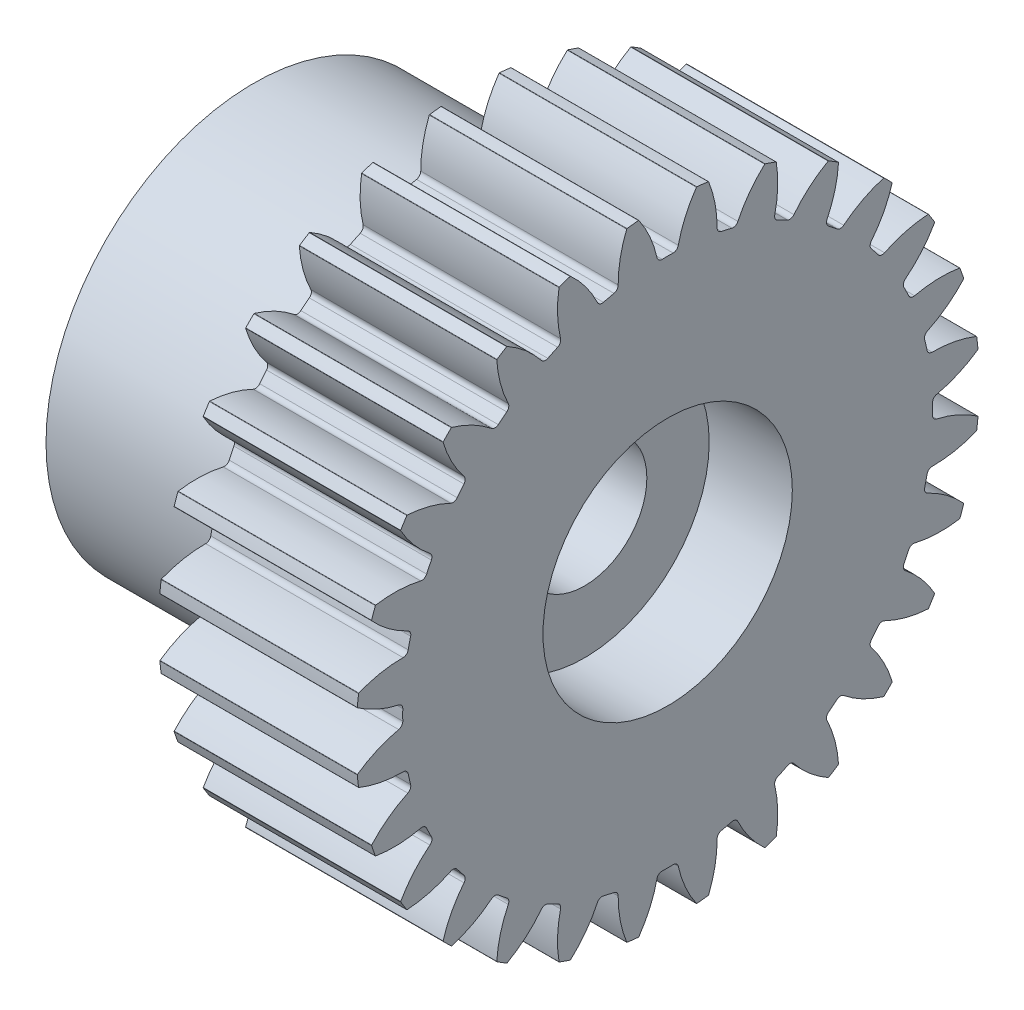
from build123d import *
from build123d.topology import SkipClean

# Parameters (mm, degrees)
BASPROSKE_W                = 5
BASPROSKE_H                = 7.5
TOOTHCUT_DEPTH             = 12.7260394
BREAKS_R                   = 0.01
ROOTFILLETS_R              = 0.126
TEETHCUTS_COUNT            = 28
TEETHCUTS_ANGLE            = 347.142857143
BREAKS_OF_TEETHCUTS_R      = 0.01
ROOTFILLETS_OF_TEETHCUTS_R = 0.126
HUBNEARONE_START           = 5.20666667
HUBNEAONESKE_R             = 6.374
HUBNEARONE_DEPTH           = 5.20666667
BORSKE_R                   = 1.5
BORE_DEPTH                 = 50.0000508
SKETCH1_R                  = 6.374
SKETCH1_R_2                = 5
CUT_EXTRUDE1_DEPTH         = 5.20666667
SKETCH2_R                  = 3
CUT_EXTRUDE2_DEPTH         = 2.25
CUT_EXTRUDE5_DEPTH         = 3.8
SKETCH7_R                  = 8.783824002
CUT_EXTRUDE6_DEPTH         = 0.25


with BuildPart() as part:
    # BasProSke → Base-Revolve (revolve)
    with BuildSketch(Plane(origin=(0, 0, 0), x_dir=(1, 0, 0), z_dir=(0, 1, 0)), mode=Mode.PRIVATE) as base_revolve_sk:
        with Locations((2.5, 3.75)):
            Rectangle(BASPROSKE_W, BASPROSKE_H)
    revolve(base_revolve_sk.sketch.rotate(Axis((-10, 0, 0), (1, 0, 0)), 180), axis=Axis((-10, 0, 0), (1, 0, 0)))

    # TooCutSke → ToothCut (cut, through all)
    with BuildSketch(Plane(origin=(0, 0, 0), x_dir=(0, 0, -1), z_dir=(1, 0, 0))):
        with BuildLine():
            ThreePointArc((0.235575921, 6.369645201), (0, 6.374), (-0.235575921, 6.369645201))
            ThreePointArc((-0.235575921, 6.369645201), (-0.412688204, 6.956904444), (-0.713425358, 7.491506485))
            ThreePointArc((-0.713425358, 7.491506485), (0, 7.5254), (0.713425358, 7.491506485))
            ThreePointArc((0.713425358, 7.491506485), (0.412688204, 6.956904444), (0.235575921, 6.369645201))
        make_face()
    toothcut = extrude(amount=TOOTHCUT_DEPTH, mode=Mode.SUBTRACT)

    # Breaks
    breaks_edges = [part.edges().sort_by_distance(p)[0] for p in [
        (2.5, 7.467592583, -0.696463213),
        (2.5, 7.467592583, 0.696463213),
    ]]
    fillet(breaks_edges, radius=BREAKS_R)

    # RootFillets
    rootfillets_edges = [part.edges().sort_by_distance(p)[0] for p in [
        (2.5, 6.369645201, -0.235575921),
        (2.5, 6.369645201, 0.235575921),
    ]]
    fillet(rootfillets_edges, radius=ROOTFILLETS_R)

    # TeethCuts: ToothCut ×28 about axis
    teethcuts_axis = Axis((-10, 0, 0), (1, 0, 0))
    for i in range(1, TEETHCUTS_COUNT):
        add(toothcut.rotate(teethcuts_axis, i * TEETHCUTS_ANGLE / (TEETHCUTS_COUNT - 1)), mode=Mode.SUBTRACT)

    # Breaks of TeethCuts
    breaks_of_teethcuts_edges = [part.edges().sort_by_distance(p)[0] for p in [
        (2.5, 7.435342091, 0.982694249),
        (2.5, 7.125386802, 2.340697103),
        (2.5, 7.030252499, 2.612575319),
        (2.5, 6.425884373, 3.867558665),
        (2.5, 6.272636691, 4.111450954),
        (2.5, 5.404161269, 5.200484687),
        (2.5, 5.200484687, 5.404161269),
        (2.5, 4.111450954, 6.272636691),
        (2.5, 3.867558665, 6.425884373),
        (2.5, 2.612575319, 7.030252499),
        (2.5, 2.340697103, 7.125386802),
        (2.5, 0.982694249, 7.435342091),
        (2.5, 0.696463213, 7.467592583),
        (2.5, -0.696463213, 7.467592583),
        (2.5, -0.982694249, 7.435342091),
        (2.5, -2.340697103, 7.125386802),
        (2.5, -2.612575319, 7.030252499),
        (2.5, -3.867558665, 6.425884373),
        (2.5, -4.111450954, 6.272636691),
        (2.5, -5.200484687, 5.404161269),
        (2.5, -5.404161269, 5.200484687),
        (2.5, -6.272636691, 4.111450954),
        (2.5, -6.425884373, 3.867558665),
        (2.5, -7.030252499, 2.612575319),
        (2.5, -7.125386802, 2.340697103),
        (2.5, -7.435342091, 0.982694249),
        (2.5, -7.467592583, 0.696463213),
        (2.5, -7.467592583, -0.696463213),
        (2.5, -7.435342091, -0.982694249),
        (2.5, -7.125386802, -2.340697103),
        (2.5, -7.030252499, -2.612575319),
        (2.5, -6.425884373, -3.867558665),
        (2.5, -6.272636691, -4.111450954),
        (2.5, -5.404161269, -5.200484687),
        (2.5, -5.200484687, -5.404161269),
        (2.5, -4.111450954, -6.272636691),
        (2.5, -3.867558665, -6.425884373),
        (2.5, -2.612575319, -7.030252499),
        (2.5, -2.340697103, -7.125386802),
        (2.5, -0.982694249, -7.435342091),
        (2.5, -0.696463213, -7.467592583),
        (2.5, 0.696463213, -7.467592583),
        (2.5, 0.982694249, -7.435342091),
        (2.5, 2.340697103, -7.125386802),
        (2.5, 2.612575319, -7.030252499),
        (2.5, 3.867558665, -6.425884373),
        (2.5, 4.111450954, -6.272636691),
        (2.5, 5.200484687, -5.404161269),
        (2.5, 5.404161269, -5.200484687),
        (2.5, 6.272636691, -4.111450954),
        (2.5, 6.425884373, -3.867558665),
        (2.5, 7.030252499, -2.612575319),
        (2.5, 7.125386802, -2.340697103),
        (2.5, 7.435342091, -0.982694249),
    ]]
    fillet(breaks_of_teethcuts_edges, radius=BREAKS_OF_TEETHCUTS_R)

    # RootFillets of TeethCuts
    rootfillets_of_teethcuts_edges = [part.edges().sort_by_distance(p)[0] for p in [
        (2.5, 6.262365471, 1.187709858),
        (2.5, 6.157524323, 1.64704894),
        (2.5, 5.841064587, 2.551438905),
        (2.5, 5.636639464, 2.975932048),
        (2.5, 5.126868335, 3.787228152),
        (2.5, 4.833109966, 4.155589496),
        (2.5, 4.155589496, 4.833109966),
        (2.5, 3.787228152, 5.126868335),
        (2.5, 2.975932048, 5.636639464),
        (2.5, 2.551438905, 5.841064587),
        (2.5, 1.64704894, 6.157524323),
        (2.5, 1.187709858, 6.262365471),
        (2.5, 0.235575921, 6.369645201),
        (2.5, -0.235575921, 6.369645201),
        (2.5, -1.187709858, 6.262365471),
        (2.5, -1.64704894, 6.157524323),
        (2.5, -2.551438905, 5.841064587),
        (2.5, -2.975932048, 5.636639464),
        (2.5, -3.787228152, 5.126868335),
        (2.5, -4.155589496, 4.833109966),
        (2.5, -4.833109966, 4.155589496),
        (2.5, -5.126868335, 3.787228152),
        (2.5, -5.636639464, 2.975932048),
        (2.5, -5.841064587, 2.551438905),
        (2.5, -6.157524323, 1.64704894),
        (2.5, -6.262365471, 1.187709858),
        (2.5, -6.369645201, 0.235575921),
        (2.5, -6.369645201, -0.235575921),
        (2.5, -6.262365471, -1.187709858),
        (2.5, -6.157524323, -1.64704894),
        (2.5, -5.841064587, -2.551438905),
        (2.5, -5.636639464, -2.975932048),
        (2.5, -5.126868335, -3.787228152),
        (2.5, -4.833109966, -4.155589496),
        (2.5, -4.155589496, -4.833109966),
        (2.5, -3.787228152, -5.126868335),
        (2.5, -2.975932048, -5.636639464),
        (2.5, -2.551438905, -5.841064587),
        (2.5, -1.64704894, -6.157524323),
        (2.5, -1.187709858, -6.262365471),
        (2.5, -0.235575921, -6.369645201),
        (2.5, 0.235575921, -6.369645201),
        (2.5, 1.187709858, -6.262365471),
        (2.5, 1.64704894, -6.157524323),
        (2.5, 2.551438905, -5.841064587),
        (2.5, 2.975932048, -5.636639464),
        (2.5, 3.787228152, -5.126868335),
        (2.5, 4.155589496, -4.833109966),
        (2.5, 4.833109966, -4.155589496),
        (2.5, 5.126868335, -3.787228152),
        (2.5, 5.636639464, -2.975932048),
        (2.5, 5.841064587, -2.551438905),
        (2.5, 6.157524323, -1.64704894),
        (2.5, 6.262365471, -1.187709858),
    ]]
    fillet(rootfillets_of_teethcuts_edges, radius=ROOTFILLETS_OF_TEETHCUTS_R)

    # HubNeaOneSke → HubNearOne (add)
    with SkipClean():  # the faces are left unmerged after this step: merging them gives an invalid solid
        with BuildSketch(Plane.ZY.offset(HUBNEARONE_START)):
            Circle(HUBNEAONESKE_R)
        extrude(amount=-HUBNEARONE_DEPTH)

    # BorSke → Bore (cut, symmetric)
    with SkipClean():  # the faces are left unmerged after this step: merging them gives an invalid solid
        with BuildSketch(Plane(origin=(0, 0, 0), x_dir=(0, 0, -1), z_dir=(1, 0, 0))):
            with Locations(Location((0, 0, 0), (0, 0, 180))):
                Circle(BORSKE_R)
        extrude(amount=BORE_DEPTH, both=True, mode=Mode.SUBTRACT)

    # Sketch1 → Cut-Extrude1 (cut)
    with BuildSketch(Plane.ZY.offset(5.20666667)):
        Circle(SKETCH1_R)
        Circle(SKETCH1_R_2, mode=Mode.SUBTRACT)
    extrude(amount=-CUT_EXTRUDE1_DEPTH, mode=Mode.SUBTRACT)

    # Sketch2 → Cut-Extrude2 (cut)
    with BuildSketch(Plane(origin=(5, 0, 0), x_dir=(0, 0, -1), z_dir=(1, 0, 0))):
        Circle(SKETCH2_R)
    extrude(amount=-CUT_EXTRUDE2_DEPTH, mode=Mode.SUBTRACT)

    # Sketch5 → Cut-Extrude5 (cut)
    with BuildSketch(Plane.ZY.offset(5.20666667)):
        Polygon((0, 4.394554346), (0.45984669, 3.640061364), (1.071968818, 4.277262382), (1.329733803, 3.432113963), (2.081090438, 3.897067557), (2.120577398, 3.014367485), (2.96395804, 3.27785891), (2.782685863, 2.413070476), (3.665097803, 2.458543597), (3.274456487, 1.666004639), (4.140454539, 1.490602212), (3.564989514, 0.820110868), (4.360159835, 0.434854073), (3.636029685, -0.071460221), (4.3104088, -0.642364283), (3.483113286, -0.952687936), (3.994327473, -1.673367263), (3.115848615, -1.768201501), (3.431776408, -2.59337316), (2.557312262, -2.466759197), (2.658102756, -3.344574618), (1.842599122, -3.004468076), (1.721919279, -3.879770889), (1.016617249, -3.347541912), (0.682049827, -4.165333621), (0.131266121, -3.474424114), (-0.396166777, -4.183319857), (-0.757824393, -3.377142206), (-1.444982219, -3.932599458), (-1.594789467, -3.061808768), (-2.398495568, -3.428926107), (-2.327039507, -2.54823736), (-3.196794073, -2.703947454), (-2.90856455, -1.868697563), (-3.789717702, -1.803216572), (-3.302825239, -1.06588736), (-4.140010884, -0.783329698), (-3.485048725, -0.190250271), (-4.22566341, 0.291629927), (-3.443785235, 0.703194208), (-4.041293417, 1.354118636), (-3.181627508, 1.558307673), (-3.598485549, 2.337376355), (-2.715047877, 2.3213602), (-2.925063053, 3.179621386), (-2.073363255, 2.944406393), (-2.063339541, 3.827932377), (-1.296893049, 3.388297969), (-1.067460271, 4.241573562), (-0.434425736, 3.625143586), align=None)
    extrude(amount=-CUT_EXTRUDE5_DEPTH, mode=Mode.SUBTRACT)

    # Sketch7 → Cut-Extrude6 (cut)
    with BuildSketch(Plane(origin=(5, 0, 0), x_dir=(0, 0, -1), z_dir=(1, 0, 0))):
        Circle(SKETCH7_R)
    extrude(amount=-CUT_EXTRUDE6_DEPTH, mode=Mode.SUBTRACT)


solid = part.part
